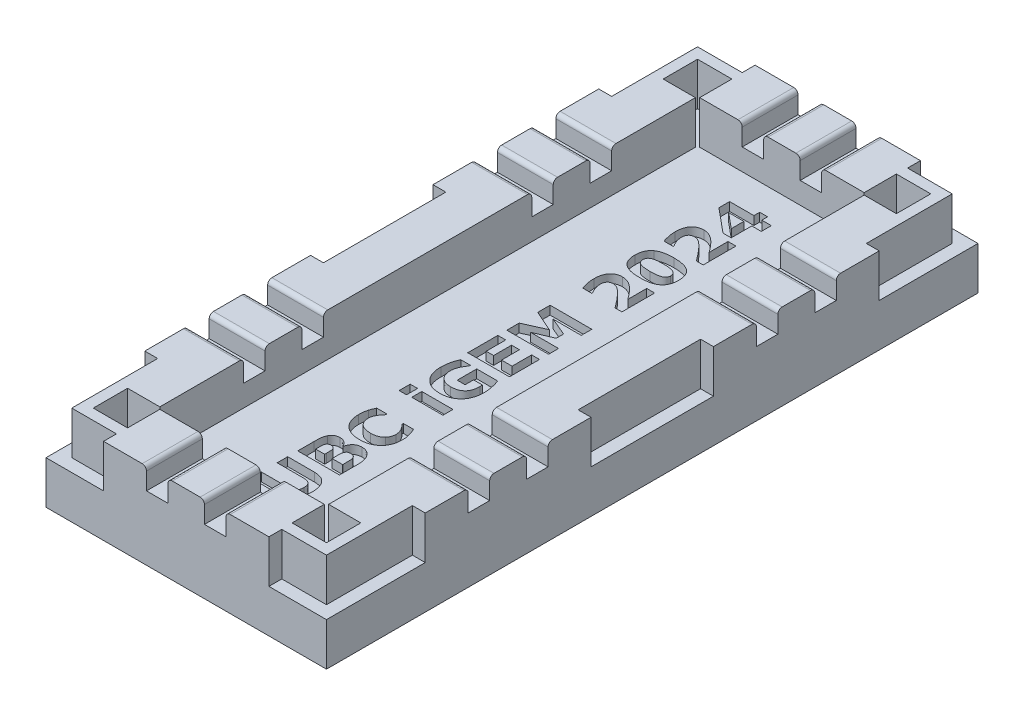
from build123d import *

# Parameters (mm, degrees)
SKETCH1_W                                  = 240
SKETCH1_H                                  = 200
BOSS_EXTRUDE1_DEPTH                        = 20
SKETCH7_W                                  = 120
SKETCH7_H                                  = 50
BOSS_EXTRUDE6_DEPTH                        = 20
FILLET1_R                                  = 2
SKETCH2_W                                  = 39.3
SKETCH2_H                                  = 125.7
CUT_EXTRUDE1_DEPTH                         = 10
CUT_EXTRUDE3_DEPTH                         = 5
MIRROR4_AT_THE_SECOND_PLANE_COPY_1_DEPTH   = 5
SKETCH11_W                                 = 104.748042719
SKETCH11_H                                 = 5
CUT_EXTRUDE4_DEPTH                         = 5
MIRROR6_AT_THE_SECOND_PLANE_COPY_1_SKETC_W = 104.748042719
MIRROR6_AT_THE_SECOND_PLANE_COPY_1_SKETC_H = 5
MIRROR6_AT_THE_SECOND_PLANE_COPY_1_DEPTH   = 5
SHELL1_START                               = 10
SHELL1_OUTLINE_W                           = 80.35
SHELL1_OUTLINE_H                           = 28.5
SHELL1_DEPTH                               = 10
FILLET3_R                                  = 1
SKETCH13_W                                 = 7.252545243
SKETCH13_H                                 = 2.335565418
SKETCH13_W_2                               = 1.720942939
SKETCH13_H_2                               = 2.581414408
CUT_EXTRUDE5_DEPTH                         = 2
CUT_EXTRUDE6_DEPTH                         = 10
MIRROR7_AT_THE_SECOND_PLANE_COPY_1_DEPTH   = 10
SKETCH15_W                                 = 101.789001661
SKETCH15_H                                 = 87.14110882
CUT_EXTRUDE7_DEPTH                         = 194.132079158
SKETCH16_W                                 = 296.201154453
SKETCH16_H                                 = 328.833485028
SKETCH16_W_2                               = 65.3
SKETCH16_H_2                               = 151.7
CUT_EXTRUDE10_DEPTH                        = 194.132079158


# Read off the part's stored shape, not the designer's step: Shell1
with BuildPart() as part:
    # Sketch1 → Boss-Extrude1 (new body)
    with BuildSketch(Plane(origin=(0, 0, 0), x_dir=(1, 0, 0), z_dir=(0, 1, 0))):
        Rectangle(SKETCH1_W, SKETCH1_H)
    extrude(amount=BOSS_EXTRUDE1_DEPTH)

    # Sketch7 → Boss-Extrude6 (add)
    with BuildSketch(Plane(origin=(0, 0, 0), x_dir=(1, 0, 0), z_dir=(0, 1, 0))):
        with Locations((0, 125)):
            Rectangle(SKETCH7_W, SKETCH7_H)
        with Locations((0, -125)):
            Rectangle(SKETCH7_W, SKETCH7_H)
    extrude(amount=BOSS_EXTRUDE6_DEPTH)

    # Fillet1
    fillet1_edges = [part.edges().sort_by_distance(p)[0] for p in [
        (-120, 20, 0),
        (90, 20, 100),
        (-90, 20, 100),
        (-60, 10, 150),
        (60, 10, 150),
        (-60, 20, 125),
        (0, 20, 150),
        (60, 20, 125),
        (-90, 20, -100),
        (60, 20, -125),
        (0, 20, -150),
        (60, 10, -150),
        (-60, 10, -150),
        (-60, 20, -125),
        (120, 20, 0),
        (120, 10, 100),
        (-120, 10, 100),
        (-120, 10, -100),
        (120, 10, -100),
        (90, 20, -100),
    ]]
    fillet(fillet1_edges, radius=FILLET1_R)

    # Sketch2 → Cut-Extrude1 (cut)
    with BuildSketch(Plane(origin=(0, 20, 0), x_dir=(1, 0, 0), z_dir=(0, 1, 0))):
        Rectangle(SKETCH2_W, SKETCH2_H)
    extrude(amount=-CUT_EXTRUDE1_DEPTH, mode=Mode.SUBTRACT)

    # Sketch10 → Cut-Extrude3 (cut)
    with BuildSketch(Plane(origin=(0, 20, 0), x_dir=(1, 0, 0), z_dir=(0, 1, 0))):
        Polygon((-9.25, -40.5), (-9.25, -33.162899401), (-4.25, -33.162899401), (-4.25, -40.5), (-4.25, -156.832928994), (-9.25, -156.832928994), align=None)
    cut_extrude3 = extrude(amount=-CUT_EXTRUDE3_DEPTH, mode=Mode.SUBTRACT)

    # Mirror4: Cut-Extrude3 across plane
    add(cut_extrude3.mirror(Plane(origin=(0, 0, 0), x_dir=(0, 0, 1), z_dir=(1, 0, 0))), mode=Mode.SUBTRACT)

    # Mirror4 at the second plane: Cut-Extrude3 across plane
    add(cut_extrude3.mirror(Plane.XY), mode=Mode.SUBTRACT)

    # Mirror4 at the second plane copy 1 sketc → Mirror4 at the second plane copy 1 (cut)
    with BuildSketch(Plane(origin=(0, 20, 0), x_dir=(-1, 0, 0), z_dir=(0, 1, 0))):
        Polygon((-9.25, -40.5), (-9.25, -33.162899401), (-4.25, -33.162899401), (-4.25, -40.5), (-4.25, -156.832928994), (-9.25, -156.832928994), align=None)
    extrude(amount=-MIRROR4_AT_THE_SECOND_PLANE_COPY_1_DEPTH, mode=Mode.SUBTRACT)

    # Sketch11 → Cut-Extrude4 (cut)
    with BuildSketch(Plane(origin=(0, 20, 0), x_dir=(1, 0, 0), z_dir=(0, 1, 0))):
        with Locations((-72.024021359, 26.75)):
            Rectangle(SKETCH11_W, SKETCH11_H)
        with Locations((-72.024021359, 40.35)):
            Rectangle(SKETCH11_W, SKETCH11_H)
    cut_extrude4 = extrude(amount=-CUT_EXTRUDE4_DEPTH, mode=Mode.SUBTRACT)

    # Mirror6: Cut-Extrude4 across plane
    add(cut_extrude4.mirror(Plane.XY), mode=Mode.SUBTRACT)

    # Mirror6 at the second plane: Cut-Extrude4 across plane
    add(cut_extrude4.mirror(Plane(origin=(0, 0, 0), x_dir=(0, 0, 1), z_dir=(1, 0, 0))), mode=Mode.SUBTRACT)

    # Mirror6 at the second plane copy 1 sketc → Mirror6 at the second plane copy 1 (cut)
    with BuildSketch(Plane(origin=(0, 20, 0), x_dir=(-1, 0, 0), z_dir=(0, 1, 0))):
        with Locations((-72.024021359, 26.75)):
            Rectangle(MIRROR6_AT_THE_SECOND_PLANE_COPY_1_SKETC_W, MIRROR6_AT_THE_SECOND_PLANE_COPY_1_SKETC_H)
        with Locations((-72.024021359, 40.35)):
            Rectangle(MIRROR6_AT_THE_SECOND_PLANE_COPY_1_SKETC_W, MIRROR6_AT_THE_SECOND_PLANE_COPY_1_SKETC_H)
    extrude(amount=-MIRROR6_AT_THE_SECOND_PLANE_COPY_1_DEPTH, mode=Mode.SUBTRACT)

    # Shell1 outline → Shell1 (cut)
    with BuildSketch(Plane(origin=(0, 0, 0), x_dir=(1, 0, 0), z_dir=(0, 1, 0)).offset(SHELL1_START)):
        Polygon((-29.65, 72.85), (-19.25, 72.85), (-19.25, 140), (-50, 140), (-50, 90), (-110, 90), (-110, 52.85), (-29.65, 52.85), align=None)
        Polygon((19.25, 72.85), (29.65, 72.85), (29.65, 52.85), (110, 52.85), (110, 90), (50, 90), (50, 140), (19.25, 140), align=None)
        Polygon((-110, -52.85), (-110, -90), (-50, -90), (-50, -140), (-19.25, -140), (-19.25, -72.85), (-29.65, -72.85), (-29.65, -52.85), align=None)
        with Locations((-69.825, 0)):
            Rectangle(SHELL1_OUTLINE_W, SHELL1_OUTLINE_H)
        Polygon((29.65, -72.85), (19.25, -72.85), (19.25, -140), (50, -140), (50, -90), (110, -90), (110, -52.85), (29.65, -52.85), align=None)
        with Locations((69.825, 0)):
            Rectangle(SHELL1_OUTLINE_W, SHELL1_OUTLINE_H)
    extrude(amount=SHELL1_DEPTH, mode=Mode.SUBTRACT)

    # Fillet3
    fillet3_edges = [part.edges().sort_by_distance(p)[0] for p in [
        (-4.25, 16.5, 150),
        (-4.25, 19.414213562, 149.414213562),
        (-9.25, 16.5, 150),
        (-9.25, 19.414213562, 149.414213562),
        (-4.25, 20, 105.425),
        (-9.25, 20, 105.425),
        (-9.25, 19.414213562, -149.414213562),
        (-9.25, 16.5, -150),
        (-9.25, 20, -105.425),
        (-4.25, 16.5, -150),
        (-4.25, 19.414213562, -149.414213562),
        (-4.25, 20, -105.425),
        (9.25, 16.5, 150),
        (9.25, 20, 105.425),
        (9.25, 19.414213562, 149.414213562),
        (4.25, 16.5, 150),
        (4.25, 19.414213562, 149.414213562),
        (4.25, 20, 105.425),
        (4.25, 16.5, -150),
        (4.25, 19.414213562, -149.414213562),
        (9.25, 19.414213562, -149.414213562),
        (9.25, 16.5, -150),
        (4.25, 20, -105.425),
        (9.25, 20, -105.425),
        (-120, 16.5, -24.25),
        (-120, 16.5, -29.25),
        (-119.414213562, 19.414213562, -24.25),
        (-119.414213562, 19.414213562, -29.25),
        (-68.825, 20, -24.25),
        (-68.825, 20, -29.25),
        (-120, 16.5, -37.85),
        (-120, 16.5, -42.85),
        (-68.825, 20, -37.85),
        (-68.825, 20, -42.85),
        (-119.414213562, 19.414213562, -37.85),
        (-119.414213562, 19.414213562, -42.85),
        (68.825, 20, -29.25),
        (119.414213562, 19.414213562, -29.25),
        (119.414213562, 19.414213562, -24.25),
        (68.825, 20, -24.25),
        (120, 16.5, -29.25),
        (120, 16.5, -24.25),
        (68.825, 20, -42.85),
        (119.414213562, 19.414213562, -42.85),
        (119.414213562, 19.414213562, -37.85),
        (68.825, 20, -37.85),
        (120, 16.5, -42.85),
        (120, 16.5, -37.85),
        (-120, 16.5, 29.25),
        (-120, 16.5, 24.25),
        (-68.825, 20, 29.25),
        (-119.414213562, 19.414213562, 29.25),
        (-119.414213562, 19.414213562, 24.25),
        (-68.825, 20, 24.25),
        (-120, 16.5, 42.85),
        (-120, 16.5, 37.85),
        (-68.825, 20, 42.85),
        (-119.414213562, 19.414213562, 42.85),
        (-119.414213562, 19.414213562, 37.85),
        (-68.825, 20, 37.85),
        (120, 16.5, 24.25),
        (120, 16.5, 29.25),
        (119.414213562, 19.414213562, 24.25),
        (119.414213562, 19.414213562, 29.25),
        (68.825, 20, 24.25),
        (68.825, 20, 29.25),
        (120, 16.5, 37.85),
        (120, 16.5, 42.85),
        (68.825, 20, 37.85),
        (68.825, 20, 42.85),
        (119.414213562, 19.414213562, 37.85),
        (119.414213562, 19.414213562, 42.85),
    ]]
    fillet(fillet3_edges, radius=FILLET3_R)

    # Sketch13 → Cut-Extrude5 (cut)
    # profile 1 of 12: a face of its own
    with BuildSketch(Plane(origin=(0, 10, 0), x_dir=(1, 0, 0), z_dir=(0, 1, 0))):
        Polygon((2.787359078, 56.729654742), (2.787359078, 55.37748529), (5, 55.37748529), (5, 53.041919872), (2.787359078, 53.041919872), (2.787359078, 48.247864542), (0.880108701, 48.247864542), (-4.711035156, 52.886343558), (-4.711035156, 55.37748529), (0.943491644, 55.37748529), (0.943491644, 56.729654742), align=None)
        Polygon((0.943491644, 53.041919872), (-2.596349692, 53.041919872), (0.943491644, 50.110938929), align=None, mode=Mode.SUBTRACT)
    # profile 2 of 12: a face of its own
    with BuildSketch(Plane(origin=(0, 10, 0), x_dir=(1, 0, 0), z_dir=(0, 1, 0))):
        with BuildLine():
            Line((5, 47.141544081), (5, 39.520225351))
            Line((5, 39.520225351), (3.409664338, 39.520225351))
            add(Edge.make_bspline(
                [(3.409664338, 39.520225351), (3.190599668, 39.81675512), (2.747057383, 40.417141716), (2.167094132, 41.14339637), (1.704390868, 41.703253096), (1.381972101, 42.083056551), (1.083256561, 42.417759603), (0.887687077, 42.622007507), (0.79559811, 42.718182933)],
                knots=[0, 0, 0, 0, 1.605452287, 3.25057426, 4.046675402, 4.768563423, 5.420146126, 6, 6, 6, 6], degree=3))
            add(Edge.make_bspline(
                [(0.79559811, 42.718182933), (0.732570292, 42.782561984), (0.609352585, 42.908421315), (0.423765416, 43.085974145), (0.244476812, 43.249198615), (0.074088064, 43.400664381), (-0.092796487, 43.534082219), (-0.252790737, 43.654099684), (-0.406497488, 43.759962438), (-0.599845109, 43.881290453), (-0.837875375, 44.00401532), (-1.125540586, 44.112139625), (-1.412736444, 44.178491494), (-1.604945873, 44.187117789), (-1.699385013, 44.191356186)],
                knots=[0, 0, 0, 0, 1.090093853, 2.131104457, 3.107135244, 4.023908394, 4.888948297, 5.691514549, 6.4435893, 7.146498757, 8.452673016, 9.675803408, 10.85804184, 12, 12, 12, 12], degree=3))
            add(Edge.make_bspline(
                [(-1.699385013, 44.191356186), (-1.754483363, 44.189605987), (-1.861179083, 44.186216799), (-2.017224671, 44.167846758), (-2.162681909, 44.132103765), (-2.300488192, 44.087839319), (-2.42643972, 44.024206924), (-2.544199113, 43.950411254), (-2.650531499, 43.859818439), (-2.749307162, 43.758726543), (-2.834556733, 43.642742478), (-2.911599654, 43.517157005), (-2.971430142, 43.377241787), (-3.024398474, 43.226819474), (-3.063653395, 43.063897589), (-3.092633036, 42.889340485), (-3.109905835, 42.703165878), (-3.111960528, 42.574807759), (-3.113016713, 42.508827152)],
                knots=[0, 0, 0, 0, 1.058578686, 2.049894692, 3.010224385, 3.931750511, 4.822578239, 5.71281177, 6.594427321, 7.498813824, 8.420995957, 9.353043897, 10.321837571, 11.3367408, 12.413304787, 13.535187771, 14.732999458, 16, 16, 16, 16], degree=3))
            add(Edge.make_bspline(
                [(-3.113016713, 42.508827152), (-3.110052719, 42.405568465), (-3.104041103, 42.196137688), (-3.053985994, 41.878413923), (-2.980602684, 41.552282773), (-2.873221808, 41.222921491), (-2.74714341, 40.895094854), (-2.596251992, 40.578640505), (-2.438170844, 40.269132893), (-2.314289691, 40.074405983), (-2.252545243, 39.977350819)],
                knots=[0, 0, 0, 0, 0.914703558, 1.855215137, 2.844920106, 3.875005138, 4.922433174, 5.955639304, 6.981056277, 8, 8, 8, 8], degree=3))
            Line((-2.252545243, 39.977350819), (-2.252545243, 39.766074342))
            Line((-2.252545243, 39.766074342), (-4.363389317, 39.766074342))
            add(Edge.make_bspline(
                [(-4.363389317, 39.766074342), (-4.396975153, 39.85152697), (-4.470639347, 40.038951181), (-4.568658946, 40.352153969), (-4.66491051, 40.720660415), (-4.763825821, 41.132864511), (-4.849735205, 41.573321973), (-4.910075419, 42.024211578), (-4.95119256, 42.474770211), (-4.954991729, 42.775713815), (-4.956884148, 42.92561802)],
                knots=[0, 0, 0, 0, 0.681686624, 1.495150967, 2.435076171, 3.509887788, 4.642826517, 5.765734475, 6.887081194, 8, 8, 8, 8], degree=3))
            add(Edge.make_bspline(
                [(-4.956884148, 42.92561802), (-4.954912362, 43.072306092), (-4.951074185, 43.357841566), (-4.914531776, 43.772464491), (-4.853049644, 44.160650299), (-4.769612134, 44.521836328), (-4.662431161, 44.856562797), (-4.529987596, 45.163893905), (-4.371768891, 45.443672956), (-4.191325, 45.69718541), (-3.986517109, 45.920499957), (-3.762299213, 46.116633841), (-3.516918106, 46.283180062), (-3.250583577, 46.417510178), (-2.964907945, 46.521931142), (-2.659732708, 46.596780352), (-2.333869778, 46.641015432), (-2.109911454, 46.646854566), (-1.995172081, 46.649846099)],
                knots=[0, 0, 0, 0, 1.302669921, 2.535710425, 3.693104205, 4.791067539, 5.825099944, 6.810730835, 7.758000335, 8.67487823, 9.568447078, 10.443087854, 11.315285082, 12.19521531, 13.085757283, 14.011200708, 14.981089066, 16, 16, 16, 16], degree=3))
            add(Edge.make_bspline(
                [(-1.995172081, 46.649846099), (-1.918295051, 46.648245135), (-1.764899121, 46.645050664), (-1.536586701, 46.623146341), (-1.311198259, 46.589276583), (-1.089189633, 46.538876948), (-0.870129482, 46.472993238), (-0.653296175, 46.39436831), (-0.439122967, 46.302496277), (-0.229338943, 46.193054838), (-0.018163961, 46.072147599), (0.191952814, 45.932794317), (0.405837655, 45.781094454), (0.620958688, 45.614342324), (0.835471411, 45.430057751), (1.055741697, 45.23549192), (1.273520634, 45.021368665), (1.417594688, 44.872241147), (1.490889788, 44.796375188)],
                knots=[0, 0, 0, 0, 0.907170522, 1.810115022, 2.704515666, 3.595334857, 4.494160497, 5.402400165, 6.316123003, 7.242010315, 8.19323076, 9.186549597, 10.215937183, 11.28746875, 12.397107329, 13.552885457, 14.755074217, 16, 16, 16, 16], degree=3))
            add(Edge.make_bspline(
                [(1.490889788, 44.796375188), (1.669671754, 44.600991906), (2.021428479, 44.216571794), (2.422503942, 43.720261203), (2.710127438, 43.347225494), (2.892573427, 43.11547907), (3.035611297, 42.923413887), (3.11966375, 42.809753418), (3.156132565, 42.760438229)],
                knots=[0, 0, 0, 0, 1.811045763, 3.563265038, 4.362127914, 5.033096026, 5.580478129, 6, 6, 6, 6], degree=3))
            Line((3.156132565, 42.760438229), (3.156132565, 47.141544081))
            Line((3.156132565, 47.141544081), (5, 47.141544081))
        make_face()
    # profile 3 of 12: a face of its own
    with BuildSketch(Plane(origin=(0, 10, 0), x_dir=(1, 0, 0), z_dir=(0, 1, 0))):
        with BuildLine():
            add(Edge.make_bspline(
                [(0.138720336, 37.553433421), (0.339837036, 37.551198694), (0.731017162, 37.546852061), (1.301575539, 37.503210957), (1.839727263, 37.435290008), (2.344336806, 37.340402007), (2.812295891, 37.218717557), (3.235819492, 37.059739443), (3.620265586, 36.877229499), (3.845547684, 36.720963882), (3.955141787, 36.64494457)],
                knots=[0, 0, 0, 0, 1.210994604, 2.355433537, 3.443919748, 4.476135166, 5.446013627, 6.351277171, 7.197937607, 8, 8, 8, 8], degree=3))
            add(Edge.make_bspline(
                [(3.955141787, 36.64494457), (4.057367971, 36.5617232), (4.260610648, 36.396265258), (4.524020765, 36.101981434), (4.745368417, 35.772676286), (4.897303004, 35.472877401), (4.999247268, 35.217133399), (5.063592063, 35.011802969), (5.122267484, 34.796985151), (5.167723638, 34.570405454), (5.201934481, 34.333084121), (5.226664862, 34.085073274), (5.242295446, 33.825562266), (5.244648027, 33.648682389), (5.245848991, 33.558387312)],
                knots=[0, 0, 0, 0, 1.363120718, 2.710110989, 4.070537742, 5.460816644, 6.180869889, 6.918733188, 7.687278466, 8.485437086, 9.309407483, 10.168795045, 11.065191617, 12, 12, 12, 12], degree=3))
            add(Edge.make_bspline(
                [(5.245848991, 33.558387312), (5.241905689, 33.384062955), (5.234297073, 33.047703496), (5.173081199, 32.562988904), (5.069699732, 32.118069919), (4.926806373, 31.711596248), (4.739854178, 31.34454147), (4.516760058, 31.013155063), (4.251279595, 30.717979546), (4.045332533, 30.554230832), (3.94169692, 30.471830054)],
                knots=[0, 0, 0, 0, 1.200851745, 2.317047666, 3.359233085, 4.342911255, 5.278031965, 6.189548012, 7.088953741, 8, 8, 8, 8], degree=3))
            add(Edge.make_bspline(
                [(3.94169692, 30.471830054), (3.829424185, 30.3947628), (3.600170882, 30.2373967), (3.214838014, 30.049115343), (2.792701976, 29.89168932), (2.331256748, 29.768085058), (1.834031119, 29.675388633), (1.301418942, 29.61187027), (0.734794995, 29.570336966), (0.344952566, 29.565716964), (0.144482422, 29.563341204)],
                knots=[0, 0, 0, 0, 0.822750793, 1.680001256, 2.58557045, 3.544707477, 4.565467581, 5.642347189, 6.787615291, 8, 8, 8, 8], degree=3))
            add(Edge.make_bspline(
                [(0.144482422, 29.563341204), (-0.061754837, 29.565532126), (-0.459970452, 29.569762495), (-1.036345286, 29.613069323), (-1.570746564, 29.680774054), (-2.065452333, 29.775711056), (-2.521358164, 29.900947264), (-2.938473361, 30.06222162), (-3.323134476, 30.249194002), (-3.55325365, 30.406272972), (-3.666176943, 30.483354226)],
                knots=[0, 0, 0, 0, 1.242237956, 2.39858964, 3.479780431, 4.485821505, 5.430991799, 6.32348679, 7.177307181, 8, 8, 8, 8], degree=3))
            add(Edge.make_bspline(
                [(-3.666176943, 30.483354226), (-3.769193286, 30.566416838), (-3.974708441, 30.732124775), (-4.238285133, 31.029639616), (-4.461065672, 31.362253167), (-4.645070962, 31.729678272), (-4.784115122, 32.135791847), (-4.885860052, 32.577168574), (-4.944671996, 33.056148657), (-4.952723667, 33.387282789), (-4.956884148, 33.558387312)],
                knots=[0, 0, 0, 0, 0.915406887, 1.826214983, 2.74012738, 3.682217607, 4.664024873, 5.706462388, 6.814877053, 8, 8, 8, 8], degree=3))
            add(Edge.make_bspline(
                [(-4.956884148, 33.558387312), (-4.955682618, 33.64868302), (-4.953320425, 33.826203271), (-4.937576888, 34.086978277), (-4.913381513, 34.337057391), (-4.877300412, 34.575699285), (-4.828262853, 34.80214551), (-4.773499009, 35.018778584), (-4.706561244, 35.224310597), (-4.601886899, 35.480626422), (-4.447267393, 35.781827029), (-4.217150947, 36.109134402), (-3.948246131, 36.405401156), (-3.739143401, 36.569659884), (-3.633525124, 36.652627351)],
                knots=[0, 0, 0, 0, 0.927772364, 1.823989051, 2.683453821, 3.508702832, 4.302191287, 5.063276402, 5.803871599, 6.520953588, 7.906777029, 9.27188215, 10.622021304, 12, 12, 12, 12], degree=3))
            add(Edge.make_bspline(
                [(-3.633525124, 36.652627351), (-3.521300204, 36.729189524), (-3.292789343, 36.885084383), (-2.908970475, 37.068290297), (-2.492360426, 37.225455121), (-2.036263275, 37.346342452), (-1.54437137, 37.439204828), (-1.015826808, 37.505677425), (-0.450933502, 37.546286922), (-0.061742996, 37.551003841), (0.138720336, 37.553433421)],
                knots=[0, 0, 0, 0, 0.826423845, 1.682753026, 2.582377666, 3.535958882, 4.552416628, 5.629628825, 6.779074777, 8, 8, 8, 8], degree=3))
        make_face()
        with BuildLine():
            add(Edge.make_bspline(
                [(0.138720336, 35.094943508), (-0.002794049, 35.093990238), (-0.275052116, 35.092156251), (-0.667644343, 35.074004214), (-1.028464631, 35.048543297), (-1.357952356, 35.010483072), (-1.656192237, 34.961169576), (-1.923473104, 34.900935006), (-2.158488294, 34.828227196), (-2.363936988, 34.745989678), (-2.54162794, 34.64913888), (-2.69467252, 34.537908006), (-2.823572221, 34.410664927), (-2.931286275, 34.270097317), (-3.011274034, 34.111739825), (-3.072443859, 33.941187009), (-3.106785969, 33.754382189), (-3.110895684, 33.625106618), (-3.113016713, 33.558387312)],
                knots=[0, 0, 0, 0, 1.684598718, 3.240982106, 4.677870026, 5.990101975, 7.188004416, 8.275163324, 9.249099904, 10.113910365, 10.905306099, 11.652292794, 12.358339015, 13.054983843, 13.750418457, 14.461547751, 15.206002611, 16, 16, 16, 16], degree=3))
            add(Edge.make_bspline(
                [(-3.113016713, 33.558387312), (-3.110895681, 33.491668012), (-3.106785962, 33.362392453), (-3.072443884, 33.175587552), (-3.011273943, 33.005035023), (-2.931286606, 32.84667649), (-2.823570979, 32.706112772), (-2.694677343, 32.578854684), (-2.541608299, 32.467684345), (-2.363496496, 32.37029911), (-2.157013742, 32.289020864), (-1.921590867, 32.215742751), (-1.654258135, 32.155647372), (-1.355414385, 32.106122047), (-1.024612933, 32.068276855), (-0.661244964, 32.04269777), (-0.266085327, 32.024665897), (0.008090715, 32.022799039), (0.150244508, 32.021831116)],
                knots=[0, 0, 0, 0, 0.791766581, 1.534129826, 2.243261137, 2.936741863, 3.631429404, 4.335491923, 5.08037989, 5.869552125, 6.738971147, 7.710171362, 8.794275798, 9.988812621, 11.304907075, 12.745337551, 14.312534512, 16, 16, 16, 16], degree=3))
            add(Edge.make_bspline(
                [(0.150244508, 32.021831116), (0.289201434, 32.022765136), (0.556986265, 32.024565091), (0.943773412, 32.043063349), (1.30096878, 32.067483158), (1.627502144, 32.109075315), (1.924420257, 32.156514098), (2.190195476, 32.220950105), (2.427221865, 32.292197549), (2.635687527, 32.376524358), (2.816464841, 32.475577579), (2.974492505, 32.586386469), (3.106149375, 32.714997304), (3.215613674, 32.855867424), (3.298888327, 33.012083539), (3.358752163, 33.181622444), (3.396338685, 33.365314373), (3.400067537, 33.492898418), (3.401981557, 33.558387312)],
                knots=[0, 0, 0, 0, 1.658832269, 3.196746878, 4.622488866, 5.931787449, 7.125569234, 8.210133994, 9.194149195, 10.078471196, 10.889203548, 11.650697572, 12.375032472, 13.07829054, 13.77251817, 14.478471121, 15.218999177, 16, 16, 16, 16], degree=3))
            add(Edge.make_bspline(
                [(3.401981557, 33.558387312), (3.400068186, 33.623876875), (3.3963406, 33.751462223), (3.358745104, 33.935144911), (3.298913291, 34.10471679), (3.215521541, 34.260812329), (3.106775331, 34.40178813), (2.97377315, 34.528364287), (2.816557237, 34.639341559), (2.635707586, 34.738476019), (2.42683161, 34.821967534), (2.190341985, 34.897522561), (1.921851262, 34.956560743), (1.624132619, 35.009519497), (1.295502071, 35.045529443), (0.936895825, 35.074962985), (0.547988509, 35.091838226), (0.278306115, 35.093884415), (0.138720336, 35.094943508)],
                knots=[0, 0, 0, 0, 0.778971247, 1.517574904, 2.221693305, 2.914116855, 3.615547377, 4.332711038, 5.092226179, 5.900851692, 6.782875619, 7.766611013, 8.854037796, 10.053520173, 11.366075456, 12.788704916, 14.337855446, 16, 16, 16, 16], degree=3))
        make_face(mode=Mode.SUBTRACT)
    # profile 4 of 12: a face of its own
    with BuildSketch(Plane(origin=(0, 10, 0), x_dir=(1, 0, 0), z_dir=(0, 1, 0))):
        with BuildLine():
            Line((5, 28.211171751), (5, 20.589853021))
            Line((5, 20.589853021), (3.409664338, 20.589853021))
            add(Edge.make_bspline(
                [(3.409664338, 20.589853021), (3.190599668, 20.88638279), (2.747057383, 21.486769386), (2.167094132, 22.21302404), (1.704390868, 22.772880767), (1.381972101, 23.152684221), (1.083256561, 23.487387273), (0.887687077, 23.691635177), (0.79559811, 23.787810603)],
                knots=[0, 0, 0, 0, 1.605452287, 3.25057426, 4.046675402, 4.768563423, 5.420146126, 6, 6, 6, 6], degree=3))
            add(Edge.make_bspline(
                [(0.79559811, 23.787810603), (0.732570292, 23.852189654), (0.609352585, 23.978048985), (0.423765416, 24.155601815), (0.244476812, 24.318826285), (0.074088064, 24.470292051), (-0.092796487, 24.60370989), (-0.252790737, 24.723727355), (-0.406497488, 24.829590108), (-0.599845109, 24.950918123), (-0.837875375, 25.07364299), (-1.125540586, 25.181767295), (-1.412736444, 25.248119164), (-1.604945873, 25.256745459), (-1.699385013, 25.260983856)],
                knots=[0, 0, 0, 0, 1.090093853, 2.131104457, 3.107135244, 4.023908394, 4.888948297, 5.691514549, 6.4435893, 7.146498757, 8.452673016, 9.675803408, 10.85804184, 12, 12, 12, 12], degree=3))
            add(Edge.make_bspline(
                [(-1.699385013, 25.260983856), (-1.754483363, 25.259233658), (-1.861179083, 25.25584447), (-2.017224671, 25.237474428), (-2.162681909, 25.201731435), (-2.300488192, 25.157466989), (-2.42643972, 25.093834595), (-2.544199113, 25.020038924), (-2.650531499, 24.929446109), (-2.749307162, 24.828354213), (-2.834556733, 24.712370148), (-2.911599654, 24.586784675), (-2.971430142, 24.446869457), (-3.024398474, 24.296447144), (-3.063653395, 24.133525259), (-3.092633036, 23.958968155), (-3.109905835, 23.772793548), (-3.111960528, 23.644435429), (-3.113016713, 23.578454822)],
                knots=[0, 0, 0, 0, 1.058578686, 2.049894692, 3.010224385, 3.931750511, 4.822578239, 5.71281177, 6.594427321, 7.498813824, 8.420995957, 9.353043897, 10.321837571, 11.3367408, 12.413304787, 13.535187771, 14.732999458, 16, 16, 16, 16], degree=3))
            add(Edge.make_bspline(
                [(-3.113016713, 23.578454822), (-3.110052719, 23.475196136), (-3.104041103, 23.265765358), (-3.053985994, 22.948041593), (-2.980602684, 22.621910443), (-2.873221808, 22.292549161), (-2.74714341, 21.964722525), (-2.596251992, 21.648268175), (-2.438170844, 21.338760563), (-2.314289691, 21.144033653), (-2.252545243, 21.046978489)],
                knots=[0, 0, 0, 0, 0.914703558, 1.855215137, 2.844920106, 3.875005138, 4.922433174, 5.955639304, 6.981056277, 8, 8, 8, 8], degree=3))
            Line((-2.252545243, 21.046978489), (-2.252545243, 20.835702012))
            Line((-2.252545243, 20.835702012), (-4.363389317, 20.835702012))
            add(Edge.make_bspline(
                [(-4.363389317, 20.835702012), (-4.396975153, 20.92115464), (-4.470639347, 21.108578851), (-4.568658946, 21.421781639), (-4.66491051, 21.790288086), (-4.763825821, 22.202492181), (-4.849735205, 22.642949643), (-4.910075419, 23.093839248), (-4.95119256, 23.544397881), (-4.954991729, 23.845341485), (-4.956884148, 23.99524569)],
                knots=[0, 0, 0, 0, 0.681686624, 1.495150967, 2.435076171, 3.509887788, 4.642826517, 5.765734475, 6.887081194, 8, 8, 8, 8], degree=3))
            add(Edge.make_bspline(
                [(-4.956884148, 23.99524569), (-4.954912362, 24.141933762), (-4.951074185, 24.427469237), (-4.914531776, 24.842092162), (-4.853049644, 25.230277969), (-4.769612134, 25.591463998), (-4.662431161, 25.926190468), (-4.529987596, 26.233521576), (-4.371768891, 26.513300626), (-4.191325, 26.76681308), (-3.986517109, 26.990127627), (-3.762299213, 27.186261512), (-3.516918106, 27.352807733), (-3.250583577, 27.487137848), (-2.964907945, 27.591558812), (-2.659732708, 27.666408023), (-2.333869778, 27.710643103), (-2.109911454, 27.716482236), (-1.995172081, 27.719473769)],
                knots=[0, 0, 0, 0, 1.302669921, 2.535710425, 3.693104205, 4.791067539, 5.825099944, 6.810730835, 7.758000335, 8.67487823, 9.568447078, 10.443087854, 11.315285082, 12.19521531, 13.085757283, 14.011200708, 14.981089066, 16, 16, 16, 16], degree=3))
            add(Edge.make_bspline(
                [(-1.995172081, 27.719473769), (-1.918295051, 27.717872805), (-1.764899121, 27.714678334), (-1.536586701, 27.692774011), (-1.311198259, 27.658904253), (-1.089189633, 27.608504619), (-0.870129482, 27.542620908), (-0.653296175, 27.46399598), (-0.439122967, 27.372123947), (-0.229338943, 27.262682508), (-0.018163961, 27.141775269), (0.191952814, 27.002421987), (0.405837655, 26.850722124), (0.620958688, 26.683969994), (0.835471411, 26.499685422), (1.055741697, 26.30511959), (1.273520634, 26.090996335), (1.417594688, 25.941868817), (1.490889788, 25.866002858)],
                knots=[0, 0, 0, 0, 0.907170522, 1.810115022, 2.704515666, 3.595334857, 4.494160497, 5.402400165, 6.316123003, 7.242010315, 8.19323076, 9.186549597, 10.215937183, 11.28746875, 12.397107329, 13.552885457, 14.755074217, 16, 16, 16, 16], degree=3))
            add(Edge.make_bspline(
                [(1.490889788, 25.866002858), (1.669671754, 25.670619576), (2.021428479, 25.286199464), (2.422503942, 24.789888873), (2.710127438, 24.416853164), (2.892573427, 24.18510674), (3.035611297, 23.993041557), (3.11966375, 23.879381088), (3.156132565, 23.830065899)],
                knots=[0, 0, 0, 0, 1.811045763, 3.563265038, 4.362127914, 5.033096026, 5.580478129, 6, 6, 6, 6], degree=3))
            Line((3.156132565, 23.830065899), (3.156132565, 28.211171751))
            Line((3.156132565, 28.211171751), (5, 28.211171751))
        make_face()
    # profile 5 of 12: a face of its own
    with BuildSketch(Plane(origin=(0, 10, 0), x_dir=(1, 0, 0), z_dir=(0, 1, 0))):
        Polygon((5, 13.583156769), (5, 11.124666856), (-1.524601746, 11.124666856), (2.664434583, 9.338420279), (2.664434583, 7.625160121), (-1.524601746, 5.838913543), (5, 5.838913543), (5, 3.503348126), (-4.711035156, 3.503348126), (-4.711035156, 6.382470298), (0.125275469, 8.549014533), (-4.711035156, 10.709796683), (-4.711035156, 13.583156769), align=None)
    # profile 6 of 12: a face of its own
    with BuildSketch(Plane(origin=(0, 10, 0), x_dir=(1, 0, 0), z_dir=(0, 1, 0))):
        Polygon((5, 1.4136317), (5, -5.593064552), (-4.711035156, -5.593064552), (-4.711035156, 1.4136317), (-2.867167722, 1.4136317), (-2.867167722, -3.134574639), (-1.146224782, -3.134574639), (-1.146224782, 1.044858213), (0.697642652, 1.044858213), (0.697642652, -3.134574639), (3.156132565, -3.134574639), (3.156132565, 1.4136317), align=None)
    # profile 7 of 12: a face of its own
    with BuildSketch(Plane(origin=(0, 10, 0), x_dir=(1, 0, 0), z_dir=(0, 1, 0))):
        with BuildLine():
            add(Edge.make_bspline(
                [(4.475650198, -7.805705474), (4.519354839, -7.923859504), (4.612512661, -8.17570855), (4.743574124, -8.583890089), (4.866671289, -9.047274178), (4.996208031, -9.552124696), (5.106381276, -10.084227717), (5.187397941, -10.625264318), (5.237323662, -11.165972628), (5.243010567, -11.526628491), (5.245848991, -11.706637515)],
                knots=[0, 0, 0, 0, 0.756485239, 1.612472169, 2.573171414, 3.635272123, 4.742182008, 5.834553763, 6.919191659, 8, 8, 8, 8], degree=3))
            add(Edge.make_bspline(
                [(5.245848991, -11.706637515), (5.241962961, -11.909112321), (5.234392087, -12.303579456), (5.17063924, -12.878829296), (5.062937634, -13.419584917), (4.916847086, -13.928231287), (4.72267015, -14.400885619), (4.491042888, -14.842463027), (4.211679163, -15.247896521), (3.893490591, -15.618759753), (3.53655883, -15.9505899), (3.145758166, -16.239699566), (2.72146993, -16.48347792), (2.264846611, -16.681095463), (1.776896349, -16.838089964), (1.255150105, -16.944841813), (0.702111097, -17.014888699), (0.322052776, -17.021601157), (0.127196165, -17.025042647)],
                knots=[0, 0, 0, 0, 1.160705024, 2.261318311, 3.313123859, 4.319096107, 5.290496718, 6.238021168, 7.172737693, 8.107230733, 9.03451477, 9.961071912, 10.888559376, 11.833805606, 12.808979065, 13.821966168, 14.883317984, 16, 16, 16, 16], degree=3))
            add(Edge.make_bspline(
                [(0.127196165, -17.025042647), (-0.058682323, -17.02067815), (-0.422730133, -17.012130168), (-0.955049114, -16.943336637), (-1.460067022, -16.832867692), (-1.937766829, -16.677677821), (-2.386372436, -16.473696921), (-2.808700267, -16.227656485), (-3.203463564, -15.935836699), (-3.565000576, -15.598836264), (-3.895700628, -15.226075236), (-4.177610929, -14.810267907), (-4.422741814, -14.363406013), (-4.616779655, -13.8775432), (-4.772219277, -13.359136807), (-4.876169413, -12.804694831), (-4.946971316, -12.216810998), (-4.953520434, -11.812500101), (-4.956884148, -11.604840667)],
                knots=[0, 0, 0, 0, 1.061573339, 2.079118747, 3.060574866, 4.011305467, 4.942696719, 5.870461571, 6.798745348, 7.740825567, 8.68941507, 9.638984161, 10.604583371, 11.595514188, 12.621960228, 13.691449096, 14.814297672, 16, 16, 16, 16], degree=3))
            add(Edge.make_bspline(
                [(-4.956884148, -11.604840667), (-4.954318925, -11.445386322), (-4.949235323, -11.129389392), (-4.919388643, -10.661251886), (-4.863951384, -10.205248288), (-4.792453594, -9.753475749), (-4.684946461, -9.294730481), (-4.534849919, -8.818874824), (-4.346707534, -8.316660693), (-4.193287983, -7.980233106), (-4.113698935, -7.805705474)],
                knots=[0, 0, 0, 0, 0.974479143, 1.931163549, 2.86485946, 3.780778834, 4.725046501, 5.741022375, 6.828116267, 8, 8, 8, 8], degree=3))
            Line((-4.113698935, -7.805705474), (-1.883771756, -7.805705474))
            Line((-1.883771756, -7.805705474), (-1.883771756, -8.091889065))
            add(Edge.make_bspline(
                [(-1.883771756, -8.091889065), (-1.906716104, -8.126531064), (-1.957410079, -8.203070203), (-2.043059993, -8.326945943), (-2.137489474, -8.476111594), (-2.284548962, -8.694884397), (-2.45960062, -8.978067997), (-2.581693909, -9.213466955), (-2.640525683, -9.326896107)],
                knots=[0, 0, 0, 0, 0.515980687, 1.140024195, 1.869947604, 2.707876564, 4.413660046, 6, 6, 6, 6], degree=3))
            add(Edge.make_bspline(
                [(-2.640525683, -9.326896107), (-2.672756546, -9.393740863), (-2.73882048, -9.530753251), (-2.823836627, -9.749019276), (-2.905177649, -9.981830174), (-2.978097, -10.22950925), (-3.037034138, -10.489919732), (-3.082413494, -10.759686706), (-3.106467195, -11.03779789), (-3.110821171, -11.225783758), (-3.113016713, -11.320577771)],
                knots=[0, 0, 0, 0, 0.861448091, 1.765719082, 2.717953576, 3.724891765, 4.761927522, 5.816719679, 6.89905606, 8, 8, 8, 8], degree=3))
            add(Edge.make_bspline(
                [(-3.113016713, -11.320577771), (-3.110164997, -11.430782772), (-3.104578279, -11.646682304), (-3.068710383, -11.963218824), (-3.004292393, -12.263584213), (-2.918860854, -12.549882667), (-2.805175217, -12.820581595), (-2.662381265, -13.075068024), (-2.499039638, -13.320076357), (-2.36711736, -13.466852812), (-2.300562624, -13.540901474)],
                knots=[0, 0, 0, 0, 1.091217493, 2.137773647, 3.148547478, 4.129133693, 5.092188092, 6.048375109, 7.015406034, 8, 8, 8, 8], degree=3))
            add(Edge.make_bspline(
                [(-2.300562624, -13.540901474), (-2.231129169, -13.608753509), (-2.090799964, -13.745886571), (-1.846186727, -13.91943259), (-1.579009792, -14.07619004), (-1.283734201, -14.208811415), (-0.962723927, -14.314570988), (-0.616833633, -14.387928819), (-0.248028071, -14.435679856), (0.006035391, -14.440927383), (0.136799641, -14.443628239)],
                knots=[0, 0, 0, 0, 0.871242595, 1.760833901, 2.686460846, 3.652134751, 4.663748384, 5.717797841, 6.825370436, 8, 8, 8, 8], degree=3))
            add(Edge.make_bspline(
                [(0.136799641, -14.443628239), (0.270078203, -14.441217619), (0.528956778, -14.436535262), (0.904701948, -14.395518364), (1.257245759, -14.329288021), (1.585144219, -14.233472949), (1.889752999, -14.11198958), (2.170660406, -13.964565335), (2.424839249, -13.78559248), (2.657673098, -13.584235453), (2.862193118, -13.352834409), (3.041867765, -13.096983341), (3.191530728, -12.813783401), (3.315763592, -12.506455713), (3.407777269, -12.172177215), (3.477785429, -11.813452581), (3.51753353, -11.428392977), (3.522401475, -11.163169785), (3.524906052, -11.026711399)],
                knots=[0, 0, 0, 0, 1.162877018, 2.258757441, 3.29433279, 4.289818334, 5.235063129, 6.152415668, 7.05144509, 7.94239879, 8.832861761, 9.739671241, 10.664582224, 11.622279774, 12.626959197, 13.685538709, 14.809200461, 16, 16, 16, 16], degree=3))
            add(Edge.make_bspline(
                [(3.524906052, -11.026711399), (3.524545414, -10.976125561), (3.523787414, -10.869802624), (3.51698298, -10.707868976), (3.511542352, -10.544994826), (3.50110347, -10.438303115), (3.496095624, -10.387119882)],
                knots=[0, 0, 0, 0, 0.947728294, 1.991965744, 3.036685378, 4, 4, 4, 4], degree=3))
            Line((3.496095624, -10.387119882), (1.435189626, -10.387119882))
            Line((1.435189626, -10.387119882), (1.435189626, -12.353911813))
            Line((1.435189626, -12.353911813), (-0.408677809, -12.353911813))
            Line((-0.408677809, -12.353911813), (-0.408677809, -7.805705474))
            Line((-0.408677809, -7.805705474), (4.475650198, -7.805705474))
        make_face()
    # profile 8 of 12: a face of its own
    with BuildSketch(Plane(origin=(0, 10, 0), x_dir=(1, 0, 0), z_dir=(0, 1, 0))):
        with Locations((1.373727378, -19.913768295)):
            Rectangle(SKETCH13_W, SKETCH13_H)
    # profile 9 of 12: a face of its own
    with BuildSketch(Plane(origin=(0, 10, 0), x_dir=(1, 0, 0), z_dir=(0, 1, 0))):
        with Locations((-4.219337174, -19.913768295)):
            Rectangle(SKETCH13_W_2, SKETCH13_H_2)
    # profile 10 of 12: a face of its own
    with BuildSketch(Plane(origin=(0, 10, 0), x_dir=(1, 0, 0), z_dir=(0, 1, 0))):
        with BuildLine():
            add(Edge.make_bspline(
                [(5.245848991, -30.773379208), (5.241556228, -30.949600555), (5.233101922, -31.296656552), (5.17328717, -31.807137753), (5.071443943, -32.296870987), (4.929457053, -32.76358831), (4.750483589, -33.205121013), (4.527408056, -33.614715808), (4.267338932, -33.994815031), (4.061606502, -34.220067298), (3.958983177, -34.332427496)],
                knots=[0, 0, 0, 0, 1.089850102, 2.146385891, 3.173869964, 4.179760968, 5.160008291, 6.115072822, 7.059761785, 8, 8, 8, 8], degree=3))
            add(Edge.make_bspline(
                [(3.958983177, -34.332427496), (3.848038568, -34.438295465), (3.624492228, -34.651612698), (3.240912088, -34.92404395), (2.819806379, -35.161121156), (2.440058042, -35.326067869), (2.118408243, -35.437370727), (1.865302565, -35.510926057), (1.602961267, -35.571890876), (1.331038558, -35.621175666), (1.050675199, -35.662875321), (0.76008365, -35.687900337), (0.460358885, -35.70657835), (0.257194686, -35.708560179), (0.154085898, -35.709565986)],
                knots=[0, 0, 0, 0, 1.326589366, 2.672993315, 4.060770367, 5.505883836, 6.25107509, 7.007321983, 7.7873399, 8.582269437, 9.400071632, 10.240855478, 11.107208546, 12, 12, 12, 12], degree=3))
            add(Edge.make_bspline(
                [(0.154085898, -35.709565986), (-0.036260272, -35.705853317), (-0.409159179, -35.698579988), (-0.954067146, -35.631518817), (-1.472101576, -35.524248732), (-1.962272567, -35.375865598), (-2.421254864, -35.182794221), (-2.847342954, -34.951680217), (-3.242424741, -34.683652344), (-3.47520079, -34.471076121), (-3.591269829, -34.365079315)],
                knots=[0, 0, 0, 0, 1.119324668, 2.1928203, 3.223958197, 4.228260008, 5.200520162, 6.147632129, 7.076354466, 8, 8, 8, 8], degree=3))
            add(Edge.make_bspline(
                [(-3.591269829, -34.365079315), (-3.696426816, -34.256022231), (-3.907914238, -34.036691095), (-4.17855444, -33.660997219), (-4.413868173, -33.249571895), (-4.610724175, -32.802820982), (-4.765892728, -32.325941651), (-4.877010675, -31.82562766), (-4.943259501, -31.303347455), (-4.952287649, -30.948354573), (-4.956884148, -30.767617122)],
                knots=[0, 0, 0, 0, 0.919195442, 1.8486482, 2.803167129, 3.793795735, 4.808307604, 5.844199062, 6.902417522, 8, 8, 8, 8], degree=3))
            add(Edge.make_bspline(
                [(-4.956884148, -30.767617122), (-4.956393428, -30.668359933), (-4.955436829, -30.474869682), (-4.94084827, -30.191814102), (-4.921289403, -29.923828157), (-4.879474294, -29.592200908), (-4.814808823, -29.204474119), (-4.7421777, -28.904822537), (-4.707193766, -28.760490591)],
                knots=[0, 0, 0, 0, 0.880714095, 1.716848845, 2.514717796, 3.264532192, 4.682418473, 6, 6, 6, 6], degree=3))
            add(Edge.make_bspline(
                [(-4.707193766, -28.760490591), (-4.664108705, -28.621612355), (-4.581310973, -28.354726269), (-4.434982607, -27.98111963), (-4.28414942, -27.652264541), (-4.186257609, -27.446632632), (-4.140588669, -27.350700282)],
                knots=[0, 0, 0, 0, 1.146660616, 2.203568899, 3.161920647, 4, 4, 4, 4], degree=3))
            Line((-4.140588669, -27.350700282), (-1.760847261, -27.350700282))
            Line((-1.760847261, -27.350700282), (-1.760847261, -27.636883873))
            add(Edge.make_bspline(
                [(-1.760847261, -27.636883873), (-1.789760882, -27.669445598), (-1.850028949, -27.737317837), (-1.943169449, -27.84646079), (-2.044289807, -27.966859077), (-2.193791638, -28.146156267), (-2.382825876, -28.396964235), (-2.52216278, -28.612309765), (-2.594428997, -28.723997382)],
                knots=[0, 0, 0, 0, 0.571444814, 1.191129738, 1.882836886, 2.634784766, 4.254652092, 6, 6, 6, 6], degree=3))
            add(Edge.make_bspline(
                [(-2.594428997, -28.723997382), (-2.664236929, -28.846886536), (-2.805685787, -29.09589163), (-2.943550161, -29.429418426), (-3.032587435, -29.709146116), (-3.077362003, -29.929392289), (-3.107853006, -30.156624515), (-3.111280534, -30.311028434), (-3.113016713, -30.389240159)],
                knots=[0, 0, 0, 0, 1.439173741, 2.916136845, 3.667290802, 4.427345131, 5.203387771, 6, 6, 6, 6], degree=3))
            add(Edge.make_bspline(
                [(-3.113016713, -30.389240159), (-3.110477824, -30.475745648), (-3.105440763, -30.647369353), (-3.07497042, -30.902187581), (-3.020147889, -31.150575186), (-2.946619655, -31.393340851), (-2.845477271, -31.627774464), (-2.718252775, -31.853674636), (-2.562057311, -32.070037457), (-2.439651919, -32.20231689), (-2.377390434, -32.269600803)],
                knots=[0, 0, 0, 0, 1.001598119, 1.9871338, 2.96553644, 3.943152672, 4.919306753, 5.914963555, 6.939446524, 8, 8, 8, 8], degree=3))
            add(Edge.make_bspline(
                [(-2.377390434, -32.269600803), (-2.309583745, -32.332034441), (-2.171025631, -32.45961311), (-1.93152049, -32.625206542), (-1.660665123, -32.770051169), (-1.360441958, -32.900067806), (-1.026703819, -33.004078191), (-0.659549693, -33.075068855), (-0.259970233, -33.119887624), (0.017588233, -33.125326369), (0.161768679, -33.128151577)],
                knots=[0, 0, 0, 0, 0.80388915, 1.642689914, 2.53299325, 3.481872775, 4.4947599, 5.577680681, 6.741702658, 8, 8, 8, 8], degree=3))
            add(Edge.make_bspline(
                [(0.161768679, -33.128151577), (0.311768837, -33.125923628), (0.599876693, -33.121644368), (1.011428999, -33.069407329), (1.386636838, -32.994288328), (1.721395513, -32.879071876), (2.020823568, -32.741957475), (2.287301408, -32.588864868), (2.521133588, -32.418332338), (2.653723475, -32.287257692), (2.71821405, -32.223504117)],
                knots=[0, 0, 0, 0, 1.290334302, 2.478367041, 3.565730986, 4.578276722, 5.517838544, 6.396912514, 7.220272109, 8, 8, 8, 8], degree=3))
            add(Edge.make_bspline(
                [(2.71821405, -32.223504117), (2.776624204, -32.15678903), (2.892154246, -32.024832576), (3.038823686, -31.808811236), (3.156499876, -31.579934787), (3.248205125, -31.341825956), (3.315689405, -31.098752861), (3.366730598, -30.856410279), (3.396189151, -30.615336617), (3.400060024, -30.45525906), (3.401981557, -30.375795292)],
                knots=[0, 0, 0, 0, 1.054325691, 2.085361559, 3.097224921, 4.110091334, 5.115626892, 6.095649915, 7.054665517, 8, 8, 8, 8], degree=3))
            add(Edge.make_bspline(
                [(3.401981557, -30.375795292), (3.399995416, -30.300167635), (3.396010997, -30.148450175), (3.367969377, -29.92183692), (3.324531763, -29.696128902), (3.260202951, -29.473850088), (3.18176618, -29.256712893), (3.091757836, -29.045457401), (2.985752349, -28.843934907), (2.905928292, -28.715220777), (2.866107583, -28.651010962)],
                knots=[0, 0, 0, 0, 0.991289386, 1.988636345, 2.989438367, 4.001683697, 5.01851186, 6.01479875, 7.009670459, 8, 8, 8, 8], degree=3))
            add(Edge.make_bspline(
                [(2.866107583, -28.651010962), (2.799086235, -28.54754028), (2.667016335, -28.343644611), (2.482727048, -28.10690862), (2.33514417, -27.932313621), (2.23417018, -27.813138173), (2.139586208, -27.707238781), (2.078704196, -27.641290482), (2.049812104, -27.60999414)],
                knots=[0, 0, 0, 0, 1.674278229, 3.299273488, 4.071081905, 4.780574956, 5.421311183, 6, 6, 6, 6], degree=3))
            Line((2.049812104, -27.60999414), (2.049812104, -27.350700282))
            Line((2.049812104, -27.350700282), (4.400743084, -27.350700282))
            add(Edge.make_bspline(
                [(4.400743084, -27.350700282), (4.453977989, -27.469107265), (4.557995254, -27.700466195), (4.710217804, -28.043257711), (4.853488894, -28.385337096), (4.925202683, -28.621478965), (4.961586095, -28.741283639)],
                knots=[0, 0, 0, 0, 1.037949104, 2.028079651, 2.999562103, 4, 4, 4, 4], degree=3))
            add(Edge.make_bspline(
                [(4.961586095, -28.741283639), (5.004421769, -28.893824294), (5.086847599, -29.1873481), (5.164067273, -29.560966602), (5.209771736, -29.869797121), (5.23105018, -30.136648007), (5.244470102, -30.442236078), (5.245371714, -30.658760047), (5.245848991, -30.773379208)],
                knots=[0, 0, 0, 0, 1.383532347, 2.662238992, 3.328886368, 4.109040656, 4.999001483, 6, 6, 6, 6], degree=3))
        make_face()
    # profile 11 of 12: a face of its own
    with BuildSketch(Plane(origin=(0, 10, 0), x_dir=(1, 0, 0), z_dir=(0, 1, 0))):
        with BuildLine():
            add(Edge.make_bspline(
                [(2.021001676, -36.938810942), (2.135834195, -36.941779245), (2.360423317, -36.947584644), (2.687160369, -37.003329886), (2.994969738, -37.09114997), (3.282415269, -37.214700456), (3.547482787, -37.370068437), (3.793917062, -37.547462735), (4.012640519, -37.757602713), (4.139226852, -37.914392754), (4.202911474, -37.993272632)],
                knots=[0, 0, 0, 0, 1.09475917, 2.141126953, 3.152168046, 4.142704369, 5.117043167, 6.078545687, 7.033330935, 8, 8, 8, 8], degree=3))
            add(Edge.make_bspline(
                [(4.202911474, -37.993272632), (4.271430436, -38.089328613), (4.40755836, -38.280164856), (4.576639788, -38.587433573), (4.713481332, -38.908937379), (4.823111743, -39.248810358), (4.903771308, -39.619354907), (4.959791089, -40.029680334), (4.994197282, -40.485748637), (4.998006227, -40.805105318), (5, -40.972270956)],
                knots=[0, 0, 0, 0, 0.900219365, 1.788482918, 2.670971805, 3.564424711, 4.510769046, 5.562163026, 6.723926581, 8, 8, 8, 8], degree=3))
            Line((5, -40.972270956), (5, -45.174752151))
            Line((5, -45.174752151), (-4.711035156, -45.174752151))
            Line((-4.711035156, -45.174752151), (-4.711035156, -41.425555034))
            add(Edge.make_bspline(
                [(-4.711035156, -41.425555034), (-4.710541486, -41.331439942), (-4.70958769, -41.149604829), (-4.705841049, -40.887095211), (-4.699877008, -40.643807445), (-4.693192491, -40.420271668), (-4.681063463, -40.216067051), (-4.668157953, -40.032247924), (-4.652477333, -39.867707729), (-4.630893633, -39.673277593), (-4.585539799, -39.443346024), (-4.510417909, -39.173669198), (-4.412392074, -38.905016505), (-4.330200075, -38.730862363), (-4.288482202, -38.642467624)],
                knots=[0, 0, 0, 0, 1.191100834, 2.301266995, 3.32247628, 4.271027234, 5.131271201, 5.911180066, 6.602939548, 7.223035301, 8.386250696, 9.563798057, 10.763466492, 12, 12, 12, 12], degree=3))
            add(Edge.make_bspline(
                [(-4.288482202, -38.642467624), (-4.24037863, -38.555082717), (-4.14649073, -38.384526039), (-3.96681891, -38.160482297), (-3.766354069, -37.969249234), (-3.540529018, -37.816186883), (-3.294523859, -37.699130329), (-3.031217773, -37.613886068), (-2.750649461, -37.563414018), (-2.558140696, -37.556803917), (-2.45998033, -37.553433421)],
                knots=[0, 0, 0, 0, 1.062471767, 2.073717987, 3.049750995, 4.008349348, 4.970663542, 5.946983296, 6.953165217, 8, 8, 8, 8], degree=3))
            add(Edge.make_bspline(
                [(-2.45998033, -37.553433421), (-2.34632125, -37.557744982), (-2.123212386, -37.56620843), (-1.799163202, -37.636330667), (-1.497547426, -37.755993777), (-1.217510903, -37.917931504), (-0.962107245, -38.123087774), (-0.737146443, -38.36942586), (-0.539239297, -38.653150081), (-0.437787245, -38.864281752), (-0.385629466, -38.972827206)],
                knots=[0, 0, 0, 0, 1.021240063, 2.004659125, 2.963527431, 3.928166968, 4.902700677, 5.896727327, 6.918681, 8, 8, 8, 8], degree=3))
            Line((-0.385629466, -38.972827206), (-0.331849999, -38.972827206))
            add(Edge.make_bspline(
                [(-0.331849999, -38.972827206), (-0.315133952, -38.896322572), (-0.282373011, -38.746384985), (-0.213507173, -38.530709186), (-0.135710337, -38.325903274), (-0.042627342, -38.133886296), (0.060108174, -37.95222046), (0.178686833, -37.784999106), (0.30692412, -37.628215042), (0.449935214, -37.485611469), (0.604749117, -37.357488018), (0.771277187, -37.24414347), (0.951207426, -37.150906864), (1.14137017, -37.070940795), (1.345153065, -37.011582244), (1.560063926, -36.970821996), (1.786533831, -36.941763667), (1.941515264, -36.939811939), (2.021001676, -36.938810942)],
                knots=[0, 0, 0, 0, 1.10181943, 2.159400495, 3.183738525, 4.183475208, 5.160528738, 6.118184526, 7.065606833, 8.008818544, 8.956240851, 9.891148262, 10.838570569, 11.80433507, 12.791067958, 13.819797808, 14.881824444, 16, 16, 16, 16], degree=3))
        make_face()
        with BuildLine():
            add(Edge.make_bspline(
                [(-2.008616947, -40.134847829), (-2.09124687, -40.140597316), (-2.261302737, -40.152430001), (-2.465096768, -40.229199103), (-2.617398636, -40.321814293), (-2.718430914, -40.417582821), (-2.802491285, -40.537481784), (-2.842505816, -40.628911056), (-2.863326331, -40.676483888)],
                knots=[0, 0, 0, 0, 1.37611365, 2.832099971, 3.575724026, 4.338646544, 5.135558161, 6, 6, 6, 6], degree=3))
            add(Edge.make_bspline(
                [(-2.863326331, -40.676483888), (-2.880469479, -40.72417013), (-2.916029188, -40.823084802), (-2.94872072, -40.98465552), (-2.971826297, -41.161780037), (-2.982379957, -41.360128266), (-2.984019117, -41.586254808), (-2.989034583, -41.849372132), (-2.990414961, -42.152857164), (-2.99020396, -42.369256934), (-2.990092217, -42.483858113)],
                knots=[0, 0, 0, 0, 0.667162118, 1.383881808, 2.166847079, 3.020689487, 3.999759839, 5.147588948, 6.489417668, 8, 8, 8, 8], degree=3))
            Line((-2.990092217, -42.483858113), (-2.990092217, -42.716262238))
            Line((-2.990092217, -42.716262238), (-0.900375791, -42.716262238))
            Line((-0.900375791, -42.716262238), (-0.900375791, -42.328281799))
            add(Edge.make_bspline(
                [(-0.900375791, -42.328281799), (-0.900847936, -42.234165701), (-0.901756934, -42.052968806), (-0.905752536, -41.792392548), (-0.910819984, -41.553515408), (-0.920304415, -41.336408066), (-0.933541808, -41.139837111), (-0.960203888, -40.965118006), (-0.996788228, -40.811145546), (-1.034375643, -40.719653209), (-1.052110715, -40.676483888)],
                knots=[0, 0, 0, 0, 1.353556646, 2.605933166, 3.748016522, 4.789499618, 5.731564706, 6.579319284, 7.329672576, 8, 8, 8, 8], degree=3))
            add(Edge.make_bspline(
                [(-1.052110715, -40.676483888), (-1.078045734, -40.62432659), (-1.126824949, -40.526227872), (-1.221120897, -40.399741201), (-1.326351499, -40.301159723), (-1.446667726, -40.235307443), (-1.574159605, -40.189253382), (-1.710236455, -40.157274444), (-1.856291435, -40.137362616), (-1.956690393, -40.1357051), (-2.008616947, -40.134847829)],
                knots=[0, 0, 0, 0, 1.185047103, 2.228865504, 3.19870776, 4.098528262, 5.002595673, 5.955169327, 6.942409244, 8, 8, 8, 8], degree=3))
        make_face(mode=Mode.SUBTRACT)
        with BuildLine():
            add(Edge.make_bspline(
                [(2.026763761, -39.520225351), (1.953023318, -39.522411502), (1.813066197, -39.52656075), (1.616130796, -39.557844442), (1.445067383, -39.613491155), (1.298621824, -39.693085665), (1.174285176, -39.801935168), (1.0706615, -39.94105928), (0.983868523, -40.11095373), (0.942352079, -40.237230881), (0.920443301, -40.303869011)],
                knots=[0, 0, 0, 0, 1.190735269, 2.259979371, 3.208234232, 4.083001629, 4.93316116, 5.855523917, 6.868331482, 8, 8, 8, 8], degree=3))
            add(Edge.make_bspline(
                [(0.920443301, -40.303869011), (0.906744847, -40.356816102), (0.877297832, -40.470634336), (0.849892481, -40.657796969), (0.834020824, -40.87213552), (0.821780201, -41.198149771), (0.823210929, -41.634925024), (0.821460992, -41.990885698), (0.820567148, -42.172705484)],
                knots=[0, 0, 0, 0, 0.524312437, 1.127093368, 1.81100824, 2.585413694, 4.255876569, 6, 6, 6, 6], degree=3))
            Line((0.820567148, -42.172705484), (0.820567148, -42.716262238))
            Line((0.820567148, -42.716262238), (3.279057061, -42.716262238))
            Line((3.279057061, -42.716262238), (3.279057061, -42.535716885))
            add(Edge.make_bspline(
                [(3.279057061, -42.535716885), (3.278974112, -42.451206672), (3.278814497, -42.288588535), (3.279912217, -42.054255856), (3.276233212, -41.83851166), (3.278151037, -41.641944513), (3.274338023, -41.463336919), (3.276045374, -41.303902128), (3.273109661, -41.162417415), (3.271730495, -41.000319704), (3.261895556, -40.813029002), (3.228612943, -40.599036272), (3.178483106, -40.393438891), (3.126331492, -40.264288854), (3.100432403, -40.200151468)],
                knots=[0, 0, 0, 0, 1.290084578, 2.482435477, 3.577096325, 4.583753231, 5.482956203, 6.303919117, 7.01744192, 7.643013823, 8.77878684, 9.876279933, 10.945336299, 12, 12, 12, 12], degree=3))
            add(Edge.make_bspline(
                [(3.100432403, -40.200151468), (3.071771625, -40.139887889), (3.017172805, -40.02508569), (2.916259015, -39.871286631), (2.794668554, -39.752871432), (2.661678362, -39.662072279), (2.515987473, -39.599481173), (2.362113362, -39.552829486), (2.197351176, -39.525972374), (2.084478576, -39.52216974), (2.026763761, -39.520225351)],
                knots=[0, 0, 0, 0, 1.176739053, 2.241689486, 3.223911615, 4.151030007, 5.066033208, 6.009243398, 6.982072299, 8, 8, 8, 8], degree=3))
        make_face(mode=Mode.SUBTRACT)
    # profile 12 of 12: a face of its own
    with BuildSketch(Plane(origin=(0, 10, 0), x_dir=(1, 0, 0), z_dir=(0, 1, 0))):
        with BuildLine():
            add(Edge.make_bspline(
                [(1.512017436, -47.510317568), (1.658117535, -47.513706434), (1.9428832, -47.520311719), (2.357411184, -47.5695508), (2.744982873, -47.656562292), (3.107029839, -47.774612183), (3.441363342, -47.930059691), (3.751964278, -48.116132586), (4.033217485, -48.341116319), (4.288224496, -48.598381297), (4.5168247, -48.887909948), (4.712363571, -49.212568176), (4.877148099, -49.568574773), (5.015348627, -49.955040345), (5.115871512, -50.3760664), (5.193849339, -50.827473253), (5.236960864, -51.311818098), (5.242825893, -51.644854467), (5.245848991, -51.816516306)],
                knots=[0, 0, 0, 0, 1.078483925, 2.102087493, 3.07563418, 4.006804974, 4.907686045, 5.792049102, 6.673413646, 7.559089302, 8.461147502, 9.390096458, 10.350078799, 11.353180003, 12.414700242, 13.541405865, 14.732730623, 16, 16, 16, 16], degree=3))
            add(Edge.make_bspline(
                [(5.245848991, -51.816516306), (5.242819772, -51.988177805), (5.236942866, -52.321213512), (5.193970738, -52.804933579), (5.115991584, -53.255099563), (5.014659113, -53.675222365), (4.87752742, -54.062007781), (4.712871176, -54.418223302), (4.51624682, -54.741586999), (4.288179492, -55.030698426), (4.033899302, -55.288346201), (3.75147891, -55.510143907), (3.443571052, -55.698318074), (3.108347061, -55.850128873), (2.74757355, -55.968687572), (2.361256189, -56.055795601), (1.948018425, -56.105122439), (1.663882602, -56.111667027), (1.517779522, -56.115032264)],
                knots=[0, 0, 0, 0, 1.269417573, 2.462761791, 3.586710223, 4.645434864, 5.654699426, 6.616309069, 7.542788968, 8.446376281, 9.33355328, 10.213474434, 11.09529141, 11.995722662, 12.928471919, 13.899049301, 14.919687896, 16, 16, 16, 16], degree=3))
            Line((1.517779522, -56.115032264), (-4.711035156, -56.115032264))
            Line((-4.711035156, -56.115032264), (-4.711035156, -53.656542351))
            Line((-4.711035156, -53.656542351), (1.387172245, -53.656542351))
            add(Edge.make_bspline(
                [(1.387172245, -53.656542351), (1.469143879, -53.654753254), (1.628192667, -53.651281887), (1.858859241, -53.633577339), (2.072848893, -53.597748315), (2.272029516, -53.55328104), (2.4547094, -53.491810495), (2.620461575, -53.416686258), (2.77098949, -53.330108084), (2.904599747, -53.227374233), (3.023312628, -53.109052565), (3.125598971, -52.974011118), (3.210086887, -52.821379119), (3.282279136, -52.653957703), (3.334269574, -52.467578025), (3.375509757, -52.265592455), (3.397699401, -52.046212521), (3.400524587, -51.894668614), (3.401981557, -51.816516306)],
                knots=[0, 0, 0, 0, 1.249777764, 2.424931999, 3.522345468, 4.554462307, 5.532762845, 6.454315708, 7.324685205, 8.173785143, 9.015675824, 9.872535868, 10.746508943, 11.66914632, 12.645058795, 13.690060112, 14.808747011, 16, 16, 16, 16], degree=3))
            add(Edge.make_bspline(
                [(3.401981557, -51.816516306), (3.400674296, -51.738979381), (3.398150748, -51.589301379), (3.374130292, -51.37303247), (3.338535545, -51.172391116), (3.287897797, -50.986899342), (3.217473982, -50.818948468), (3.135438424, -50.666383082), (3.038459421, -50.529190069), (2.923990148, -50.409636263), (2.793425817, -50.304652914), (2.645688893, -50.213790545), (2.480082864, -50.136937587), (2.295259376, -50.076535285), (2.09395566, -50.026099098), (1.874093338, -49.992230388), (1.636540145, -49.973845268), (1.472355051, -49.970528364), (1.387172245, -49.968807481)],
                knots=[0, 0, 0, 0, 1.177246587, 2.272567755, 3.300601858, 4.27032395, 5.185878586, 6.060498087, 6.896988092, 7.729228332, 8.566000887, 9.434926014, 10.357220516, 11.331999863, 12.383856098, 13.506125206, 14.706123391, 16, 16, 16, 16], degree=3))
            Line((1.387172245, -49.968807481), (-4.711035156, -49.968807481))
            Line((-4.711035156, -49.968807481), (-4.711035156, -47.510317568))
            Line((-4.711035156, -47.510317568), (1.512017436, -47.510317568))
        make_face()
    extrude(amount=-CUT_EXTRUDE5_DEPTH, mode=Mode.SUBTRACT)

    # Sketch14 → Cut-Extrude6 (cut)
    with BuildSketch(Plane(origin=(0, 20, 0), x_dir=(1, 0, 0), z_dir=(0, 1, 0))):
        Polygon((-27.15, 70.35), (-27.15, 62.35), (-19.65, 62.35), (-19.65, 62.85), (-19.15, 62.85), (-19.15, 70.35), align=None)
    cut_extrude6 = extrude(amount=-CUT_EXTRUDE6_DEPTH, mode=Mode.SUBTRACT)

    # Mirror7: Cut-Extrude6 across plane
    add(cut_extrude6.mirror(Plane(origin=(0, 0, 0), x_dir=(0, 0, 1), z_dir=(1, 0, 0))), mode=Mode.SUBTRACT)

    # Mirror7 at the second plane: Cut-Extrude6 across plane
    add(cut_extrude6.mirror(Plane.XY), mode=Mode.SUBTRACT)

    # Mirror7 at the second plane copy 1 sketc → Mirror7 at the second plane copy 1 (cut)
    with BuildSketch(Plane(origin=(0, 20, 0), x_dir=(-1, 0, 0), z_dir=(0, 1, 0))):
        Polygon((-27.15, 70.35), (-27.15, 62.35), (-19.65, 62.35), (-19.65, 62.85), (-19.15, 62.85), (-19.15, 70.35), align=None)
    extrude(amount=-MIRROR7_AT_THE_SECOND_PLANE_COPY_1_DEPTH, mode=Mode.SUBTRACT)

    # Sketch15 → Cut-Extrude7 (cut, through all)
    with BuildSketch(Plane(origin=(0, 20, 0), x_dir=(1, 0, 0), z_dir=(0, 1, 0))):
        with Locations((-83.544500831, 119.42055441)):
            Rectangle(SKETCH15_W, SKETCH15_H)
        with Locations((83.544500831, 119.42055441)):
            Rectangle(SKETCH15_W, SKETCH15_H)
        with Locations((83.544500831, -119.42055441)):
            Rectangle(SKETCH15_W, SKETCH15_H)
        with Locations((-83.544500831, -119.42055441)):
            Rectangle(SKETCH15_W, SKETCH15_H)
    extrude(amount=-CUT_EXTRUDE7_DEPTH, mode=Mode.SUBTRACT)

    # Sketch16 → Cut-Extrude10 (cut, through all)
    with BuildSketch(Plane(origin=(0, 20, 0), x_dir=(1, 0, 0), z_dir=(0, 1, 0))):
        with Locations((-0.107429472, 0.127566658)):
            Rectangle(SKETCH16_W, SKETCH16_H)
        Rectangle(SKETCH16_W_2, SKETCH16_H_2, mode=Mode.SUBTRACT)
    extrude(amount=-CUT_EXTRUDE10_DEPTH, mode=Mode.SUBTRACT)


solid = part.part
